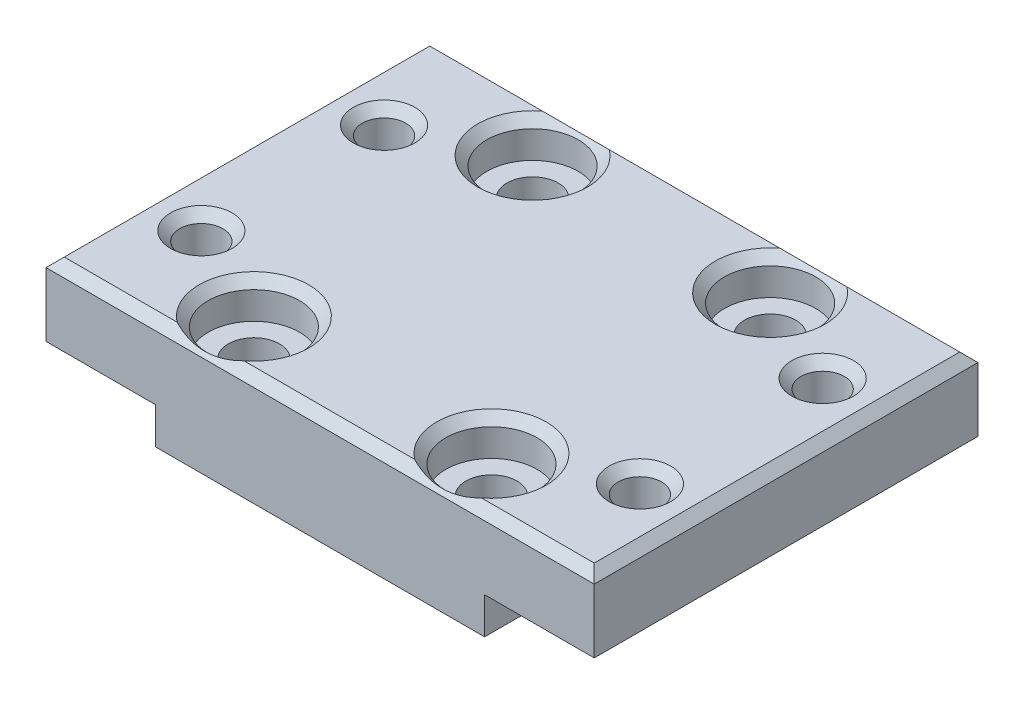
from build123d import *

# Parameters (mm, degrees)
ESBO_O1_W                = 60
ESBO_O1_H                = 42
ESBO_O1_R                = 2.8
ESBO_O1_R_2              = 2.375
RESSALTO_EXTRUS_O1_DEPTH = 8
CORTE_EXTRUS_O1_START    = 8
ESBO_O1_3_R              = 5
CORTE_EXTRUS_O1_DEPTH    = 4
RESSALTO_EXTRUS_O4_START = -4
ESBO_O1_5_W              = 36
ESBO_O1_5_H              = 42
ESBO_O1_5_R              = 2.8
RESSALTO_EXTRUS_O4_DEPTH = 4
CHANFRO1_SIZE            = 1


with BuildPart() as part:
    # Esboço1 → Ressalto-extrusão1 (new body)
    with BuildSketch(Plane(origin=(0, 0, 0), x_dir=(1, 0, 0), z_dir=(0, 1, 0))):
        Rectangle(ESBO_O1_W, ESBO_O1_H)
        with Locations(Location((-13, 15.25, 0), (0, 0, 270))):
            Circle(ESBO_O1_R, mode=Mode.SUBTRACT)
        with Locations(Location((-13, -15.25, 0), (0, 0, 270))):
            Circle(ESBO_O1_R, mode=Mode.SUBTRACT)
        with Locations(Location((13, 15.25, 0), (0, 0, 270))):
            Circle(ESBO_O1_R, mode=Mode.SUBTRACT)
        with Locations(Location((13, -15.25, 0), (0, 0, 270))):
            Circle(ESBO_O1_R, mode=Mode.SUBTRACT)
        with Locations(Location((-24, 10, 0), (0, 0, 270))):
            Circle(ESBO_O1_R_2, mode=Mode.SUBTRACT)
        with Locations(Location((-24, -10, 0), (0, 0, 270))):
            Circle(ESBO_O1_R_2, mode=Mode.SUBTRACT)
        with Locations(Location((24, -10, 0), (0, 0, 270))):
            Circle(ESBO_O1_R_2, mode=Mode.SUBTRACT)
        with Locations(Location((24, 10, 0), (0, 0, 270))):
            Circle(ESBO_O1_R_2, mode=Mode.SUBTRACT)
    extrude(amount=RESSALTO_EXTRUS_O1_DEPTH)

    # Esboço1<3> → Corte-extrusão1 (cut)
    with BuildSketch(Plane(origin=(0, 0, 0), x_dir=(1, 0, 0), z_dir=(0, 1, 0)).offset(CORTE_EXTRUS_O1_START)):
        with Locations(Location((-13, 15.25, 0), (0, 0, 270))):
            Circle(ESBO_O1_3_R)
        with Locations(Location((13, 15.25, 0), (0, 0, 270))):
            Circle(ESBO_O1_3_R)
        with Locations(Location((13, -15.25, 0), (0, 0, 270))):
            Circle(ESBO_O1_3_R)
        with Locations(Location((-13, -15.25, 0), (0, 0, 270))):
            Circle(ESBO_O1_3_R)
    extrude(amount=-CORTE_EXTRUS_O1_DEPTH, mode=Mode.SUBTRACT)

    # Esboço1<5> → Ressalto-extrusão4 (add)
    with BuildSketch(Plane(origin=(0, 0, 0), x_dir=(1, 0, 0), z_dir=(0, 1, 0)).offset(RESSALTO_EXTRUS_O4_START)):
        Rectangle(ESBO_O1_5_W, ESBO_O1_5_H)
        with Locations(Location((13, -15.25, 0), (0, 0, 270))):
            Circle(ESBO_O1_5_R, mode=Mode.SUBTRACT)
        with Locations(Location((-13, -15.25, 0), (0, 0, 270))):
            Circle(ESBO_O1_5_R, mode=Mode.SUBTRACT)
        with Locations(Location((13, 15.25, 0), (0, 0, 270))):
            Circle(ESBO_O1_5_R, mode=Mode.SUBTRACT)
        with Locations(Location((-13, 15.25, 0), (0, 0, 270))):
            Circle(ESBO_O1_5_R, mode=Mode.SUBTRACT)
    extrude(amount=RESSALTO_EXTRUS_O4_DEPTH)

    # Chanfro1
    # the kernel refuses this chamfer: 1 mm, written as the material it takes off along each edge
    with BuildSketch(Plane(origin=(-30, 8, -23.571682988), x_dir=(0.9996219169112968, 0.027495876610585647, 0), z_dir=(0, 0, 1))) as chanfro1_piece_1:
        Polygon((CHANFRO1_SIZE * 0.999621916911, -CHANFRO1_SIZE * 0.0274958766106), (-CHANFRO1_SIZE * 0.0274958766106, -CHANFRO1_SIZE * 0.999621916911), (0, 0), align=None)
    extrude(amount=47.143365976, mode=Mode.SUBTRACT)
    with BuildSketch(Plane(origin=(-32.571682988, 8, 21), x_dir=(0, -0.9996219169112968, 0.027495876610585623), z_dir=(1, 0, 0)), Plane(origin=(32.571682988, 8, -21), x_dir=(0, -0.9996219169112968, -0.027495876610585623), z_dir=(-1, 0, 0))) as chanfro1_piece_2:
        Polygon((CHANFRO1_SIZE * 0.999621916911, CHANFRO1_SIZE * 0.0274958766106), (-CHANFRO1_SIZE * 0.0274958766106, CHANFRO1_SIZE * 0.999621916911), (0, 0), align=None)
    extrude(amount=65.143365976, mode=Mode.SUBTRACT)
    with BuildSketch(Plane(origin=(30, 8, 23.571682988), x_dir=(0.027495876610585623, -0.9996219169112968, 0), z_dir=(0, 0, -1))) as chanfro1_piece_3:
        Polygon((CHANFRO1_SIZE * 0.999621916911, CHANFRO1_SIZE * 0.0274958766106), (-CHANFRO1_SIZE * 0.0274958766106, CHANFRO1_SIZE * 0.999621916911), (0, 0), align=None)
    extrude(amount=47.143365976, mode=Mode.SUBTRACT)
    with BuildSketch(Plane(origin=(-24, 8, 10), x_dir=(0, 0, 1), z_dir=(-1, 0, 0))) as chanfro1_piece_4:
        Polygon((2.375, -CHANFRO1_SIZE), (2.375 + CHANFRO1_SIZE, 0), (2.375, 0), align=None)
    revolve(axis=Axis((-24, 8, 10), (0, 1, 0)), mode=Mode.SUBTRACT)
    with BuildSketch(Plane(origin=(-24, 8, -10), x_dir=(0, 0, 1), z_dir=(-1, 0, 0))) as chanfro1_piece_5:
        Polygon((2.375, -CHANFRO1_SIZE), (2.375 + CHANFRO1_SIZE, 0), (2.375, 0), align=None)
    revolve(axis=Axis((-24, 8, -10), (0, 1, 0)), mode=Mode.SUBTRACT)
    with BuildSketch(Plane(origin=(-13, 8, -15.25), x_dir=(0, 0, 1), z_dir=(-1, 0, 0))) as chanfro1_piece_6:
        Polygon((5, -CHANFRO1_SIZE), (5 + CHANFRO1_SIZE, 0), (5, 0), align=None)
    revolve(axis=Axis((-13, 8, -15.25), (0, 1, 0)), mode=Mode.SUBTRACT)
    with BuildSketch(Plane(origin=(24, 8, -10), x_dir=(0, 0, 1), z_dir=(-1, 0, 0))) as chanfro1_piece_7:
        Polygon((2.375, -CHANFRO1_SIZE), (2.375 + CHANFRO1_SIZE, 0), (2.375, 0), align=None)
    revolve(axis=Axis((24, 8, -10), (0, 1, 0)), mode=Mode.SUBTRACT)
    with BuildSketch(Plane(origin=(24, 8, 10), x_dir=(0, 0, 1), z_dir=(-1, 0, 0))) as chanfro1_piece_8:
        Polygon((2.375, -CHANFRO1_SIZE), (2.375 + CHANFRO1_SIZE, 0), (2.375, 0), align=None)
    revolve(axis=Axis((24, 8, 10), (0, 1, 0)), mode=Mode.SUBTRACT)
    with BuildSketch(Plane(origin=(13, 8, -15.25), x_dir=(0, 0, 1), z_dir=(-1, 0, 0))) as chanfro1_piece_9:
        Polygon((5, -CHANFRO1_SIZE), (5 + CHANFRO1_SIZE, 0), (5, 0), align=None)
    revolve(axis=Axis((13, 8, -15.25), (0, 1, 0)), mode=Mode.SUBTRACT)
    with BuildSketch(Plane(origin=(-13, 8, 15.25), x_dir=(0, 0, 1), z_dir=(-1, 0, 0))) as chanfro1_piece_10:
        Polygon((5, -CHANFRO1_SIZE), (5 + CHANFRO1_SIZE, 0), (5, 0), align=None)
    revolve(axis=Axis((-13, 8, 15.25), (0, 1, 0)), mode=Mode.SUBTRACT)
    with BuildSketch(Plane(origin=(13, 8, 15.25), x_dir=(0, 0, 1), z_dir=(-1, 0, 0))) as chanfro1_piece_11:
        Polygon((5, -CHANFRO1_SIZE), (5 + CHANFRO1_SIZE, 0), (5, 0), align=None)
    revolve(axis=Axis((13, 8, 15.25), (0, 1, 0)), mode=Mode.SUBTRACT)


solid = part.part
